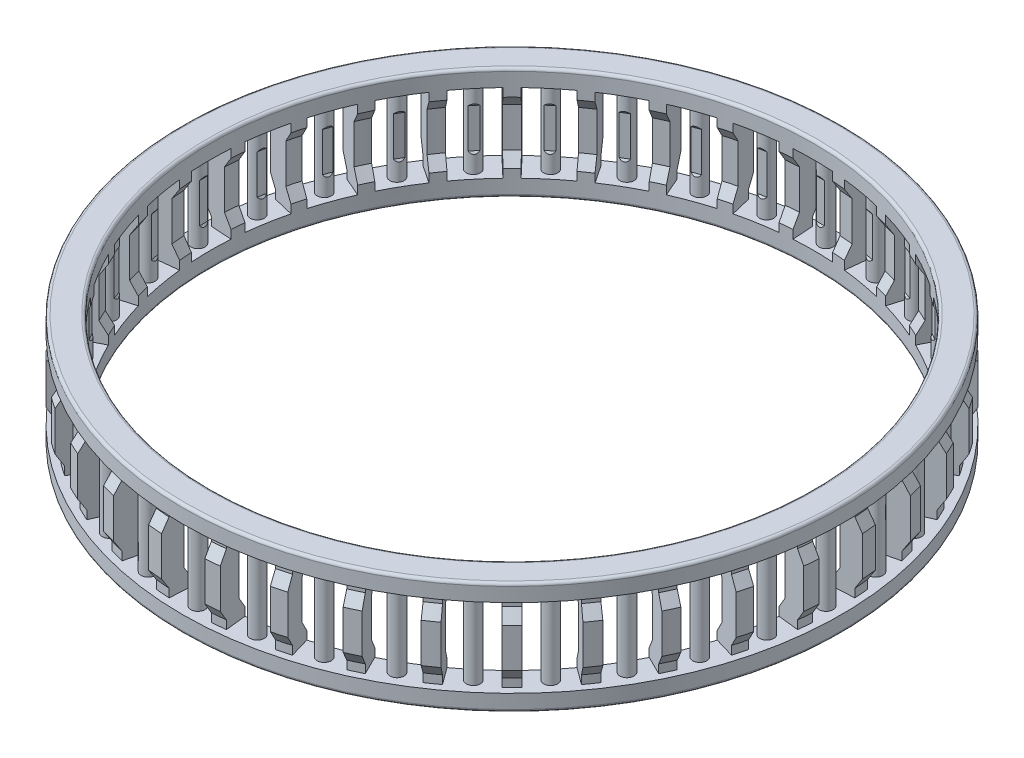
from build123d import *

# Parameters (mm, degrees)
CUT_EXTRUDE1_REACH = 91.874
CUT_EXTRUDE1_START = 3.048
SKETCH2_R          = 1.27
CIRPATTERN2_COUNT  = 36


with BuildPart() as part:
    # Sketch1 → Revolve1 (revolve)
    with BuildSketch(Plane.XY, mode=Mode.PRIVATE) as revolve1_sk:
        with BuildLine():
            Line((-59.69, 6.604), (-59.69, 13.716))
            Line((-59.69, 13.716), (-58.42, 15.748))
            Line((-58.42, 15.748), (-58.42, 17.272))
            Line((-58.42, 17.272), (-59.69, 17.272))
            Line((-59.69, 17.272), (-59.69, 19.812))
            ThreePointArc((-59.69, 19.812), (-59.541210245, 20.171210245), (-59.182, 20.32))
            Line((-59.182, 20.32), (-55.118, 20.32))
            ThreePointArc((-55.118, 20.32), (-54.758789755, 20.171210245), (-54.61, 19.812))
            Line((-54.61, 19.812), (-54.61, 15.748))
            Line((-54.61, 15.748), (-55.88, 13.716))
            Line((-55.88, 13.716), (-55.88, 6.604))
            Line((-55.88, 6.604), (-54.61, 4.572))
            Line((-54.61, 4.572), (-54.61, 0.508))
            ThreePointArc((-54.61, 0.508), (-54.758789755, 0.148789755), (-55.118, 0))
            Line((-55.118, 0), (-59.182, 0))
            ThreePointArc((-59.182, 0), (-59.541210245, 0.148789755), (-59.69, 0.508))
            Line((-59.69, 0.508), (-59.69, 3.048))
            Line((-59.69, 3.048), (-58.42, 3.048))
            Line((-58.42, 3.048), (-58.42, 4.572))
            Line((-58.42, 4.572), (-59.69, 6.604))
        make_face()
    revolve(revolve1_sk.sketch.rotate(Axis((0, 54.260509747, 0), (0, -1, 0)), 270), axis=Axis((0, 54.260509747, 0), (0, -1, 0)))

    # Cut-Extrude1: up to this face of the body (flat: up to its plane)
    cut_extrude1_end = Plane(part.part.faces().sort_by_distance((0, 17.272, -58.588828815))[0])
    # Sketch2 → Cut-Extrude1 (cut, up to the picked face)
    with BuildSketch(Plane(origin=(0, 0, 0), x_dir=(1, 0, 0), z_dir=(0, 1, 0)).offset(CUT_EXTRUDE1_START), mode=Mode.PRIVATE) as cut_extrude1_sk1:
        Polygon((-59.944, 3.937), (-59.944, -3.937), (-54.102, -3.56999159), (-54.102, 3.56999159), align=None)
        with Locations(Location((-56.896, 0, 0), (0, 0, 90))):
            Circle(SKETCH2_R, mode=Mode.SUBTRACT)
    cut_extrude1_tool1 = split(extrude(cut_extrude1_sk1.sketch, amount=CUT_EXTRUDE1_REACH, mode=Mode.PRIVATE), bisect_by=cut_extrude1_end, keep=Keep.BOTH, mode=Mode.PRIVATE)
    cut_extrude1 = cut_extrude1_tool1.solids().sort_by(Axis((-59.845955, 3.048, 0), (0, 1, 0)))[0]
    add(cut_extrude1, mode=Mode.SUBTRACT)

    # CirPattern2: Cut-Extrude1 ×36 about axis
    cirpattern2_axis = Axis((0, 0, 0), (0, 1, 0))
    for i in range(1, CIRPATTERN2_COUNT):
        add(cut_extrude1.rotate(cirpattern2_axis, i * 360 / CIRPATTERN2_COUNT), mode=Mode.SUBTRACT)


solid = part.part
